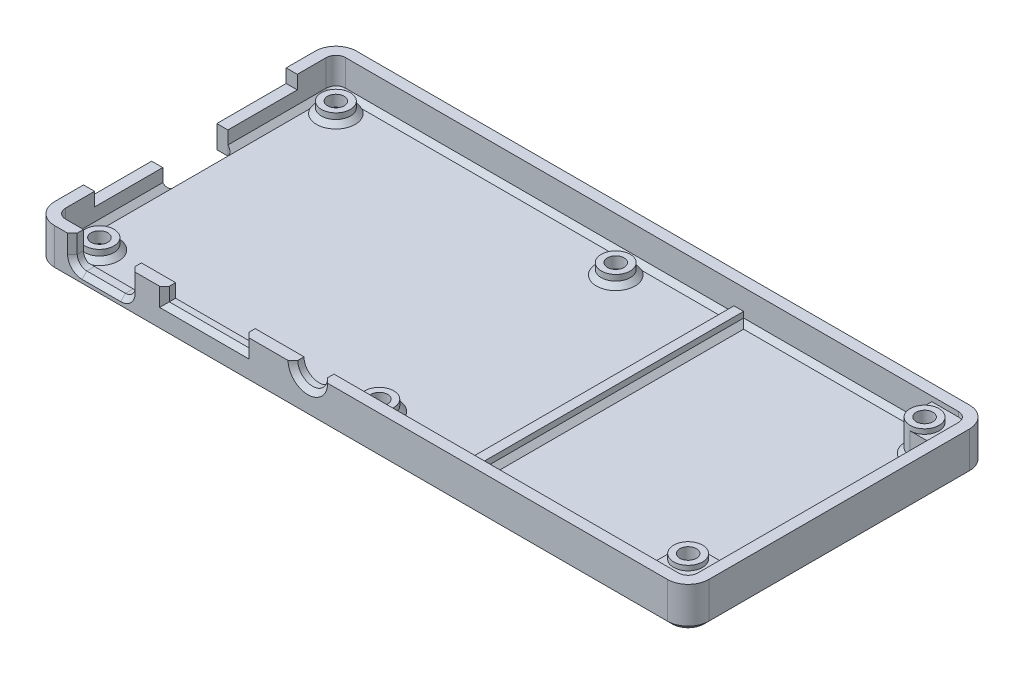
from build123d import *

# Parameters (mm, degrees)
SKETCH3_W                                         = 135.6
SKETCH3_H                                         = 62.6
SKETCH3_W_2                                       = 131
SKETCH3_H_2                                       = 58
BOSS_EXTRUDE1_DEPTH                               = 8.5
SKETCH5_W                                         = 131
SKETCH5_H                                         = 58
BOSS_EXTRUDE2_DEPTH                               = 2
SKETCH6_R                                         = 3
BOSS_EXTRUDE3_DEPTH                               = 2.2
SKETCH10_W                                        = 2
SKETCH10_H                                        = 58
BOSS_EXTRUDE4_DEPTH                               = 2.2
CUT_EXTRUDE1_REACH                                = 99.956
SKETCH11_R                                        = 3.1
SKETCH11_W                                        = 12
SKETCH11_H                                        = 5.8
SKETCH11_W_2                                      = 16.5
SKETCH11_H_2                                      = 2.8
CUT_EXTRUDE2_REACH                                = 142.155
SKETCH12_W                                        = 42
SKETCH12_H                                        = 2.8
SKETCH12_W_2                                      = 13.5
SKETCH12_H_2                                      = 3.7
FILLET6_R                                         = 2
FILLET8_R                                         = 2
CHAMFER1_SIZE                                     = 1
BOSS_EXTRUDE7_DEPTH                               = 6.5
FILLET20_R                                        = 4.3
CHAMFER5_SIZE                                     = 1
CSK_FOR_4_FLAT_HEAD_SOCKET_CAP_SCREW1_D           = 3.4544
CSK_FOR_4_FLAT_HEAD_SOCKET_CAP_SCREW1_DEPTH       = 14
CSK_FOR_4_FLAT_HEAD_SOCKET_CAP_SCREW1_CSINK_D     = 6.723761
CSK_FOR_4_FLAT_HEAD_SOCKET_CAP_SCREW1_CSINK_ANGLE = 82
CSK_FOR_4_FLAT_HEAD_SOCKET_CAP_SCREW1_TIP         = 1.037806461
CHAMFER7_SIZE                                     = 1
CHAMFER8_SIZE                                     = 1
CUT_EXTRUDE3_START                                = -1
CUT_EXTRUDE3_DEPTH                                = 1
FILLET21_R                                        = 2
CHAMFER9_SIZE                                     = 1
SKETCH30_W                                        = 3.3
SKETCH30_H                                        = 13.5
CUT_EXTRUDE4_DEPTH                                = 83.645668033
FILLET22_R                                        = 1
CHAMFER11_SIZE                                    = 1


# Some blends are built 0.0001 mm under size
with BuildPart() as part:
    # Sketch3 → Boss-Extrude1 (new body)
    with BuildSketch(Plane(origin=(0, 0, 0), x_dir=(1, 0, 0), z_dir=(0, 1, 0))):
        with Locations((-7.061766162, 3.105993834)):
            Rectangle(SKETCH3_W, SKETCH3_H)
        with Locations((-7.061766162, 3.105993834)):
            Rectangle(SKETCH3_W_2, SKETCH3_H_2, mode=Mode.SUBTRACT)
    extrude(amount=BOSS_EXTRUDE1_DEPTH)

    # Sketch5 → Boss-Extrude2 (add)
    with BuildSketch(Plane(origin=(0, 0, 0), x_dir=(1, 0, 0), z_dir=(0, 1, 0))):
        with Locations((-7.061766162, 3.105993834)):
            Rectangle(SKETCH5_W, SKETCH5_H)
    extrude(amount=BOSS_EXTRUDE2_DEPTH)

    # Sketch6 → Boss-Extrude3 (add)
    with BuildSketch(Plane(origin=(0, 2, 0), x_dir=(1, 0, 0), z_dir=(0, 1, 0))):
        with Locations(Location((-68.061766162, 27.605993834, 0), (0, 0, 270))):
            Circle(SKETCH6_R)
        with Locations(Location((-68.061766162, -21.394006166, 0), (0, 0, 270))):
            Circle(SKETCH6_R)
        with Locations(Location((-10.061766162, -21.394006166, 0), (0, 0, 270))):
            Circle(SKETCH6_R)
        with Locations(Location((-10.061766162, 27.605993834, 0), (0, 0, 270))):
            Circle(SKETCH6_R)
    extrude(amount=BOSS_EXTRUDE3_DEPTH)

    # Sketch10 → Boss-Extrude4 (add)
    with BuildSketch(Plane(origin=(0, 2, 0), x_dir=(1, 0, 0), z_dir=(0, 1, 0))):
        with Locations((10.938233838, 3.105993834)):
            Rectangle(SKETCH10_W, SKETCH10_H)
    extrude(amount=BOSS_EXTRUDE4_DEPTH)

    # Sketch11 → Cut-Extrude1 (cut, up to next)
    with BuildSketch(Plane.XY.offset(28.194006166), mode=Mode.PRIVATE) as cut_extrude1_sk1:
        with Locations((-18.061766162, 8.5)):
            Circle(SKETCH11_R)
    cut_extrude1_tool1 = extrude(cut_extrude1_sk1.sketch, amount=-CUT_EXTRUDE1_REACH, mode=Mode.PRIVATE) & part.part
    # Sketch11 → Cut-Extrude1 (cut, up to next)
    with BuildSketch(Plane.XY.offset(28.194006166), mode=Mode.PRIVATE) as cut_extrude1_sk2:
        with Locations((-60.861766162, 5.6)):
            Rectangle(SKETCH11_W, SKETCH11_H)
    cut_extrude1_tool2 = extrude(cut_extrude1_sk2.sketch, amount=-CUT_EXTRUDE1_REACH, mode=Mode.PRIVATE) & part.part
    # Sketch11 → Cut-Extrude1 (cut, up to next)
    with BuildSketch(Plane.XY.offset(28.194006166), mode=Mode.PRIVATE) as cut_extrude1_sk3:
        with Locations((-39.527982648, 7.1)):
            Rectangle(SKETCH11_W_2, SKETCH11_H_2)
    cut_extrude1_tool3 = extrude(cut_extrude1_sk3.sketch, amount=-CUT_EXTRUDE1_REACH, mode=Mode.PRIVATE) & part.part
    add(cut_extrude1_tool1.solids().sort_by_distance((-18.061766, 8.5, 28.194006))[0], mode=Mode.SUBTRACT)
    add(cut_extrude1_tool2.solids().sort_by_distance((-60.861766, 5.6, 28.194006))[0], mode=Mode.SUBTRACT)
    add(cut_extrude1_tool3.solids().sort_by_distance((-39.527983, 7.1, 28.194006))[0], mode=Mode.SUBTRACT)

    # Sketch12 → Cut-Extrude2 (cut, up to next)
    with BuildSketch(Plane.ZY.offset(74.861766162), mode=Mode.PRIVATE) as cut_extrude2_sk1:
        with Locations((-3.105993834, 7.1)):
            Rectangle(SKETCH12_W, SKETCH12_H)
    cut_extrude2_tool1 = extrude(cut_extrude2_sk1.sketch, amount=-CUT_EXTRUDE2_REACH, mode=Mode.PRIVATE) & part.part
    # Sketch12 → Cut-Extrude2 (cut, up to next)
    with BuildSketch(Plane.ZY.offset(74.861766162), mode=Mode.PRIVATE) as cut_extrude2_sk2:
        with Locations((-2.982922372, 3.85)):
            Rectangle(SKETCH12_W_2, SKETCH12_H_2)
    cut_extrude2_tool2 = extrude(cut_extrude2_sk2.sketch, amount=-CUT_EXTRUDE2_REACH, mode=Mode.PRIVATE) & part.part
    add(cut_extrude2_tool1.solids().sort_by_distance((-74.861766, 7.1, -3.105994))[0], mode=Mode.SUBTRACT)
    add(cut_extrude2_tool2.solids().sort_by_distance((-74.861766, 3.85, -2.982922))[0], mode=Mode.SUBTRACT)

    # Fillet6
    fillet6_edges = [part.edges().sort_by_distance(p)[0] for p in [
        (58.438233838, 5.25, -32.105993834),
    ]]
    fillet(fillet6_edges, radius=FILLET6_R)

    # Fillet8
    fillet8_edges = [part.edges().sort_by_distance(p)[0] for p in [
        (-72.561766162, 5.25, -32.105993834),
        (-72.561766162, 5.25, 25.894006166),
    ]]
    fillet(fillet8_edges, radius=FILLET8_R)

    # Chamfer1
    chamfer1_edges = [part.edges().sort_by_distance(p)[0] for p in [
        (-68.061766162, 2, -30.605993834),
        (-68.061766162, 2, 18.394006166),
        (-10.061766162, 2, 18.394006166),
        (-10.061766162, 2, -30.605993834),
    ]]
    chamfer(chamfer1_edges, length=CHAMFER1_SIZE)

    # Sketch24 → Boss-Extrude7 (add)
    with BuildSketch(Plane(origin=(0, 2, 0), x_dir=(1, 0, 0), z_dir=(0, 1, 0))):
        with BuildLine():
            Line((53.938233838, -18.394006166), (58.438233838, -18.394006166))
            Line((58.438233838, -18.394006166), (58.438233838, -25.894006166))
            Line((58.438233838, -25.894006166), (50.938233838, -25.894006166))
            Line((50.938233838, -25.894006166), (50.938233838, -21.394006166))
            ThreePointArc((50.938233838, -21.394006166), (51.816913494, -19.272685822), (53.938233838, -18.394006166))
        make_face()
        with BuildLine():
            Line((50.938233838, 27.605993834), (50.938233838, 32.105993834))
            Line((50.938233838, 32.105993834), (58.438233838, 32.105993834))
            Line((58.438233838, 32.105993834), (58.438233838, 24.605993834))
            Line((58.438233838, 24.605993834), (53.938233838, 24.605993834))
            ThreePointArc((53.938233838, 24.605993834), (51.816913494, 25.484673491), (50.938233838, 27.605993834))
        make_face()
    extrude(amount=BOSS_EXTRUDE7_DEPTH)

    # Fillet20
    fillet20_edges = [part.edges().sort_by_distance(p)[0] for p in [
        (-74.861766162, 4.25, -34.405993834),
        (60.738233838, 4.25, -34.405993834),
        (60.738233838, 4.25, 28.194006166),
        (-74.861766162, 4.25, 28.194006166),
    ]]
    fillet(fillet20_edges, radius=FILLET20_R)

    # Chamfer5
    # the kernel refuses this chamfer: 1 mm, written as the material it adds along each edge
    with BuildSketch(Plane(origin=(-72.561766162, 2, 23.894006166), x_dir=(0.9996219169112968, -0.027495876610586605, 0), z_dir=(0, 0, -1))) as chamfer5_piece_1:
        Polygon((CHAMFER5_SIZE * 0.999621916911, -CHAMFER5_SIZE * 0.0274958766106), (-CHAMFER5_SIZE * 0.0274958766106, -CHAMFER5_SIZE * 0.999621916911), (0, 0), align=None)
    extrude(amount=20.126928538)
    with BuildSketch(Plane(origin=(12.509916826, 2, 25.894006166), x_dir=(0, -0.027495876610586296, -0.9996219169112968), z_dir=(-1, 0, 0))) as chamfer5_piece_2_section:
        Polygon((CHAMFER5_SIZE * 0.999621916911, -CHAMFER5_SIZE * 0.0274958766106), (-CHAMFER5_SIZE * 0.0274958766106, -CHAMFER5_SIZE * 0.999621916911), (0, 0), align=None)
    chamfer5_piece_2 = extrude(amount=83.071682988, mode=Mode.PRIVATE)
    chamfer5_piece_2 = split(chamfer5_piece_2, bisect_by=Plane(origin=(12.224075332, 2.7, 25.537595909), z_dir=(0, -1, 0)), keep=Keep.TOP, mode=Mode.PRIVATE)
    add(chamfer5_piece_2)
    with BuildSketch(Plane(origin=(12.509916826, 2, 25.894006166), x_dir=(0, -0.027495876610586296, -0.9996219169112968), z_dir=(-1, 0, 0))) as chamfer5_piece_3_section:
        Polygon((CHAMFER5_SIZE * 0.999621916911, -CHAMFER5_SIZE * 0.0274958766106), (-CHAMFER5_SIZE * 0.0274958766106, -CHAMFER5_SIZE * 0.999621916911), (0, 0), align=None)
    chamfer5_piece_3 = extrude(amount=83.071682988, mode=Mode.PRIVATE)
    chamfer5_piece_3 = split(chamfer5_piece_3, bisect_by=Plane(origin=(-54.861766162, 2.8, 25.794006166), z_dir=(1, 0, 0)), keep=Keep.TOP, mode=Mode.PRIVATE)
    add(chamfer5_piece_3)
    with BuildSketch(Plane(origin=(12.509916826, 2, 25.894006166), x_dir=(0, -0.027495876610586296, -0.9996219169112968), z_dir=(-1, 0, 0))) as chamfer5_piece_4_section:
        Polygon((CHAMFER5_SIZE * 0.999621916911, -CHAMFER5_SIZE * 0.0274958766106), (-CHAMFER5_SIZE * 0.0274958766106, -CHAMFER5_SIZE * 0.999621916911), (0, 0), align=None)
    chamfer5_piece_4 = extrude(amount=83.071682988, mode=Mode.PRIVATE)
    chamfer5_piece_4 = split(chamfer5_piece_4, bisect_by=Plane(origin=(-66.861766162, 2.802568974, 25.79914411), z_dir=(-1, 0, 0)), keep=Keep.TOP, mode=Mode.PRIVATE)
    add(chamfer5_piece_4)
    with BuildSketch(Plane(origin=(-72.561766162, 2, -9.732922372), x_dir=(0.9996219169112968, -0.02749587661058639, 0), z_dir=(0, 0, -1))) as chamfer5_piece_5:
        Polygon((CHAMFER5_SIZE * 0.999621916911, -CHAMFER5_SIZE * 0.0274958766106), (-CHAMFER5_SIZE * 0.0274958766106, -CHAMFER5_SIZE * 0.999621916911), (0, 0), align=None)
    extrude(amount=20.373071462)
    with BuildSketch(Plane(origin=(-70.561766162, 2, -30.105993834), x_dir=(0, 0, -1), z_dir=(1, 0, 0))) as chamfer5_piece_6:
        Polygon((2 - CHAMFER5_SIZE, 0), (2, CHAMFER5_SIZE), (2, 0), align=None)
    revolve(axis=Axis((-70.561766162, 2, -30.105993834), (0, 1, 0)), revolution_arc=90)
    with BuildSketch(Plane(origin=(-70.561766162, 2, 23.894006166), x_dir=(0, 0, 1), z_dir=(1, 0, 0))) as chamfer5_piece_7:
        Polygon((2 - CHAMFER5_SIZE, 0), (2, -CHAMFER5_SIZE), (2, 0), align=None)
    revolve(axis=Axis((-70.561766162, 2, 23.894006166), (0, -1, 0)), revolution_arc=90)
    with BuildSketch(Plane(origin=(58.438233838, 2, -27.177676822), x_dir=(0.02749587661058907, 0.9996219169112965, 0), z_dir=(0, 0, 1))) as chamfer5_piece_8:
        Polygon((CHAMFER5_SIZE * 0.999621916911, CHAMFER5_SIZE * 0.0274958766106), (-CHAMFER5_SIZE * 0.0274958766106, CHAMFER5_SIZE * 0.999621916911), (0, 0), align=None)
    extrude(amount=48.143365976)
    with BuildSketch(Plane(origin=(53.938233838, 2, 21.394006166), x_dir=(-1, 0, 0), z_dir=(0, 0, 1))) as chamfer5_piece_9:
        Polygon((3, -CHAMFER5_SIZE), (3 + CHAMFER5_SIZE, 0), (3, 0), align=None)
    revolve(axis=Axis((53.938233838, 2, 21.394006166), (0, -1, 0)), revolution_arc=90)
    with BuildSketch(Plane(origin=(50.938233838, 2, 25.894006166), x_dir=(0.02749587661058907, 0.9996219169112965, 0), z_dir=(0, 0, -1)), Plane(origin=(53.938233838, 2, 18.394006166), x_dir=(0, 0.9996219169112968, 0.027495876610585623), z_dir=(1, 0, 0)), Plane(origin=(58.438233838, 2, -24.605993834), x_dir=(0, 0.9996219169112968, -0.027495876610585623), z_dir=(-1, 0, 0)), Plane(origin=(50.938233838, 2, -27.605993834), x_dir=(0.02749587661058907, 0.9996219169112965, 0), z_dir=(0, 0, -1))) as chamfer5_piece_10:
        Polygon((CHAMFER5_SIZE * 0.999621916911, -CHAMFER5_SIZE * 0.0274958766106), (-CHAMFER5_SIZE * 0.0274958766106, -CHAMFER5_SIZE * 0.999621916911), (0, 0), align=None)
    extrude(amount=4.5)
    with BuildSketch(Plane(origin=(9.36655085, 2, -32.105993834), x_dir=(0, 0.9996219169112968, -0.027495876610589075), z_dir=(1, 0, 0)), Plane(origin=(53.509916826, 2, 25.894006166), x_dir=(0, 0.9996219169112968, 0.027495876610585623), z_dir=(-1, 0, 0))) as chamfer5_piece_11:
        Polygon((CHAMFER5_SIZE * 0.999621916911, CHAMFER5_SIZE * 0.0274958766106), (-CHAMFER5_SIZE * 0.0274958766106, CHAMFER5_SIZE * 0.999621916911), (0, 0), align=None)
    extrude(amount=44.143365976)
    with BuildSketch(Plane(origin=(53.938233838, 2, -27.605993834), x_dir=(0, 0, 1), z_dir=(1, 0, 0))) as chamfer5_piece_12:
        Polygon((3, -CHAMFER5_SIZE), (3 + CHAMFER5_SIZE, 0), (3, 0), align=None)
    revolve(axis=Axis((53.938233838, 2, -27.605993834), (0, -1, 0)), revolution_arc=90)
    with BuildSketch(Plane(origin=(-70.561766162, 2, -32.105993834), x_dir=(0, -0.027495876610586605, 0.9996219169112968), z_dir=(1, 0, 0))) as chamfer5_piece_13:
        Polygon((CHAMFER5_SIZE * 0.999621916911, -CHAMFER5_SIZE * 0.0274958766106), (-CHAMFER5_SIZE * 0.0274958766106, -CHAMFER5_SIZE * 0.999621916911), (0, 0), align=None)
    extrude(amount=83.071682988)
    with BuildSketch(Plane(origin=(9.938233838, 2, 25.894006166), x_dir=(-0.9996219169112968, -0.027495876610586556, 0), z_dir=(0, 0, -1))) as chamfer5_piece_14:
        Polygon((CHAMFER5_SIZE * 0.999621916911, CHAMFER5_SIZE * 0.0274958766106), (-CHAMFER5_SIZE * 0.0274958766106, CHAMFER5_SIZE * 0.999621916911), (0, 0), align=None)
    extrude(amount=58)
    with BuildSketch(Plane(origin=(11.938233838, 2, -32.105993834), x_dir=(-0.027495876610585623, 0.9996219169112968, 0), z_dir=(0, 0, 1))) as chamfer5_piece_15:
        Polygon((CHAMFER5_SIZE * 0.999621916911, -CHAMFER5_SIZE * 0.0274958766106), (-CHAMFER5_SIZE * 0.0274958766106, -CHAMFER5_SIZE * 0.999621916911), (0, 0), align=None)
    extrude(amount=58)

    # CSK for #4 Flat Head Socket Cap Screw1
    with Locations(Plane(origin=(0, 0, 0), x_dir=(-1, 0, 0), z_dir=(0, -1, 0))):
        with Locations((68.061766162, 27.605993834), (68.061766162, -21.394006166), (-53.938233838, 27.605993834), (-53.938233838, -21.394006166), (10.061766162, -21.394006166), (10.061766162, 27.605993834)):
            CounterSinkHole(CSK_FOR_4_FLAT_HEAD_SOCKET_CAP_SCREW1_D / 2, CSK_FOR_4_FLAT_HEAD_SOCKET_CAP_SCREW1_CSINK_D / 2, depth=CSK_FOR_4_FLAT_HEAD_SOCKET_CAP_SCREW1_DEPTH, counter_sink_angle=CSK_FOR_4_FLAT_HEAD_SOCKET_CAP_SCREW1_CSINK_ANGLE)
            with Locations((0, 0, -(CSK_FOR_4_FLAT_HEAD_SOCKET_CAP_SCREW1_DEPTH + CSK_FOR_4_FLAT_HEAD_SOCKET_CAP_SCREW1_TIP / 2))):  # 118° drill point
                Cone(0, CSK_FOR_4_FLAT_HEAD_SOCKET_CAP_SCREW1_D / 2, CSK_FOR_4_FLAT_HEAD_SOCKET_CAP_SCREW1_TIP, mode=Mode.SUBTRACT)

    # Chamfer7
    chamfer7_edges = [part.edges().sort_by_distance(p)[0] for p in [
        (-7.061766162, 0, -34.405993834),
        (-74.861766162, 0, -3.105993834),
        (60.738233838, 0, -3.105993834),
        (-7.061766162, 0, 28.194006166),
        (59.478792997, 0, 26.934565325),
        (-73.602325321, 0, 26.934565325),
        (-73.602325321, 0, -33.146552993),
        (59.478792997, 0, -33.146552993),
    ]]
    chamfer(chamfer7_edges, length=CHAMFER7_SIZE)

    # Chamfer8
    chamfer8_edges = [part.edges().sort_by_distance(p)[0] for p in [
        (-74.861766162, 2, -2.982922372),
    ]]
    chamfer(chamfer8_edges, length=CHAMFER8_SIZE - 0.0001)  # a hair under: the kernel refuses the full size

    # Sketch29 → Cut-Extrude3 (cut)
    with BuildSketch(Plane(origin=(0, 8.5, 0), x_dir=(1, 0, 0), z_dir=(0, 1, 0)).offset(CUT_EXTRUDE3_START)):
        with BuildLine():
            Line((53.938233838, 24.605993834), (58.438233838, 24.605993834))
            Line((58.438233838, 24.605993834), (58.438233838, 30.105993834))
            ThreePointArc((58.438233838, 30.105993834), (57.8524474, 31.520207397), (56.438233838, 32.105993834))
            Line((56.438233838, 32.105993834), (50.938233838, 32.105993834))
            Line((50.938233838, 32.105993834), (50.938233838, 27.605993834))
            ThreePointArc((50.938233838, 27.605993834), (56.059554181, 29.727314178), (53.938233838, 24.605993834))
        make_face()
        with BuildLine():
            Line((53.938233838, -18.394006166), (58.438233838, -18.394006166))
            Line((58.438233838, -18.394006166), (58.438233838, -23.894006166))
            ThreePointArc((58.438233838, -23.894006166), (57.8524474, -25.308219728), (56.438233838, -25.894006166))
            Line((56.438233838, -25.894006166), (50.938233838, -25.894006166))
            Line((50.938233838, -25.894006166), (50.938233838, -21.394006166))
            ThreePointArc((50.938233838, -21.394006166), (56.059554181, -23.515326509), (53.938233838, -18.394006166))
        make_face()
    extrude(amount=CUT_EXTRUDE3_DEPTH, mode=Mode.SUBTRACT)

    # Fillet21
    fillet21_edges = [part.edges().sort_by_distance(p)[0] for p in [
        (-54.861766162, 2.7, 26.894006166),
        (-66.861766162, 2.7, 26.894006166),
    ]]
    fillet(fillet21_edges, radius=FILLET21_R)

    # Chamfer9
    chamfer9_edges = [part.edges().sort_by_distance(p)[0] for p in [
        (-18.061766162, 5.4, 28.194006166),
        (-54.861766162, 6.6, 28.194006166),
        (-60.861766162, 2.7, 28.194006166),
        (-55.4475526, 3.285786438, 28.194006166),
        (-66.275979725, 3.285786438, 28.194006166),
        (-66.861766162, 6.6, 28.194006166),
        (-47.777982648, 7.1, 28.194006166),
        (-39.527982648, 5.7, 28.194006166),
        (-31.277982648, 7.1, 28.194006166),
    ]]
    chamfer(chamfer9_edges, length=CHAMFER9_SIZE)

    # Sketch30 → Cut-Extrude4 (cut, through all)
    with BuildSketch(Plane(origin=(0, 2, 0), x_dir=(1, 0, 0), z_dir=(0, 1, 0))):
        with Locations((-73.211766162, 2.982922372)):
            Rectangle(SKETCH30_W, SKETCH30_H)
    extrude(amount=-CUT_EXTRUDE4_DEPTH, mode=Mode.SUBTRACT)

    # Fillet22
    fillet22_edges = [part.edges().sort_by_distance(p)[0] for p in [
        (-71.561766162, 1, -9.732922372),
        (-71.561766162, 1, 3.767077628),
    ]]
    fillet(fillet22_edges, radius=FILLET22_R)

    # Chamfer11
    chamfer11_edges = [part.edges().sort_by_distance(p)[0] for p in [
        (-73.211766162, 0, 3.767077628),
        (-73.211766162, 0, -9.732922372),
        (-71.854659381, 0, 3.474184409),
        (-71.854659381, 0, -9.440029154),
        (-71.561766162, 0, -2.982922372),
    ]]
    chamfer(chamfer11_edges, length=CHAMFER11_SIZE)


solid = part.part
